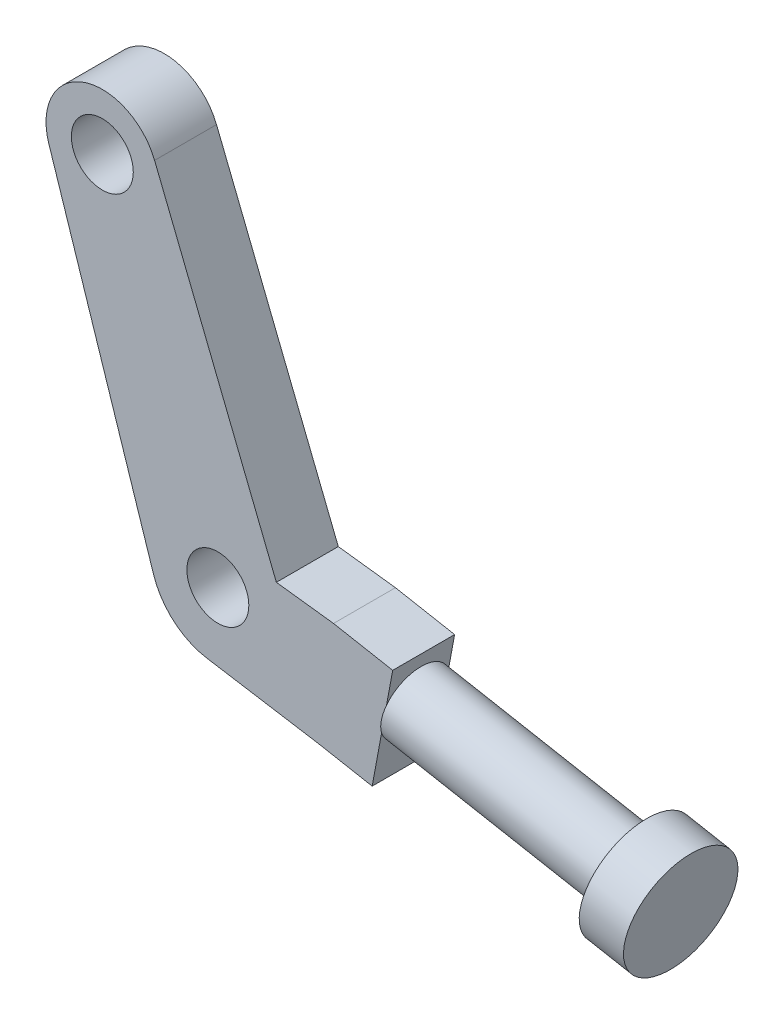
from build123d import *

# Parameters (mm, degrees)
SKETCH1_R           = 3.4925
BOSS_EXTRUDE1_DEPTH = 3.4925
SKETCH2_R           = 3.81
BOSS_EXTRUDE2_DEPTH = 25.4
SKETCH3_R           = 6.35
BOSS_EXTRUDE3_DEPTH = 5.08


with BuildPart() as part:
    # Sketch1 → Boss-Extrude1 (new, symmetric)
    with BuildSketch(Plane.XY):
        with BuildLine():
            Line((13.044359785, 3.015268576), (19.721738431, 1.775708663))
            Line((19.721738431, 1.775708663), (17.40619011, -10.697906172))
            Line((17.40619011, -10.697906172), (11.245358109, -9.554235762))
            Line((11.245358109, -9.554235762), (-1.226279862, -7.520680667))
            ThreePointArc((-1.226279862, -7.520680667), (-4.957437343, -5.786900292), (-7.243351749, -2.366063279))
            Line((-7.243351749, -2.366063279), (-19.067093918, 33.830569453))
            ThreePointArc((-19.067093918, 33.830569453), (-15.196679752, 41.771559349), (-7.13478577, 38.159732695))
            Line((-7.13478577, 38.159732695), (6.599113577, 3.81))
            Line((6.599113577, 3.81), (13.044359785, 3.015268576))
        make_face()
        with Locations((-13.030967461, 35.802288852)):
            Circle(SKETCH1_R, mode=Mode.SUBTRACT)
        Circle(SKETCH1_R, mode=Mode.SUBTRACT)
    extrude(amount=BOSS_EXTRUDE1_DEPTH, both=True)

    # Sketch2 → Boss-Extrude2 (add)
    with BuildSketch(Plane(origin=(18.746101296, -3.479945786, 0), x_dir=(0, 0, -1), z_dir=(0.9832026027704213, -0.18251751122966048, 0))):
        Circle(SKETCH2_R)
    extrude(amount=BOSS_EXTRUDE2_DEPTH)

    # Sketch3 → Boss-Extrude3 (add)
    with BuildSketch(Plane(origin=(43.719447407, -8.115890571, 0), x_dir=(0, 0, -1), z_dir=(0.9832026027704214, -0.1825175112296605, 0))):
        Circle(SKETCH3_R)
    extrude(amount=BOSS_EXTRUDE3_DEPTH)


solid = part.part
